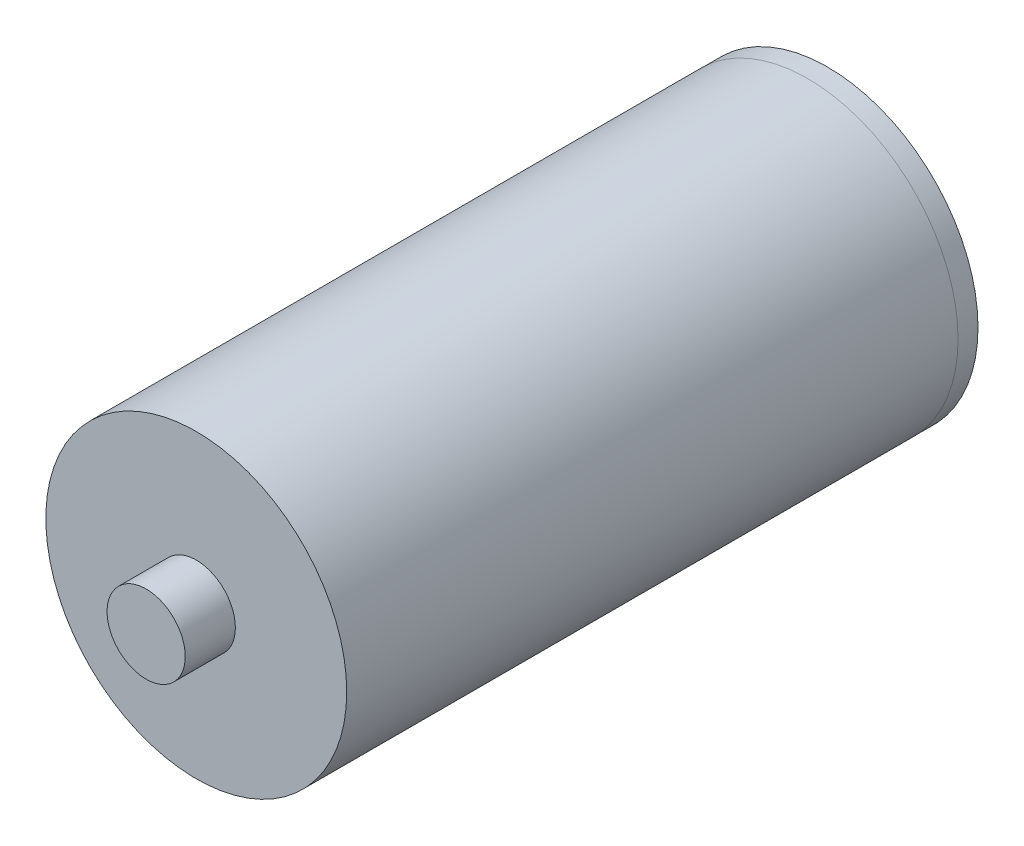
from build123d import *

# Parameters (mm, degrees)
SKETCH1_R           = 3.5
BOSS_EXTRUDE1_DEPTH = 3.25
SKETCH3_R           = 15
BOSS_EXTRUDE2_DEPTH = 2
SKETCH4_R           = 15.011076053
SKETCH4_R_2         = 13.011076053
BOSS_EXTRUDE3_DEPTH = 59
CUT_EXTRUDE1_DEPTH  = 5
SKETCH6_R           = 15.011076053
BOSS_EXTRUDE4_DEPTH = 2
SKETCH7_R           = 3.9
BOSS_EXTRUDE5_DEPTH = 5


with BuildPart() as part:
    # Sketch1 → Boss-Extrude1 (new body)
    with BuildSketch(Plane.XY):
        with Locations((0.700759494, -0.350379747)):
            Circle(SKETCH1_R)
        with BuildLine():
            Line((-1.299240506, 1.149620253), (0.700759494, 1.149620253))
            Line((0.700759494, 1.149620253), (2.700759494, 1.149620253))
            ThreePointArc((2.700759494, 1.149620253), (3.200759494, -0.350379747), (2.700759494, -1.850379747))
            Line((2.700759494, -1.850379747), (-1.299240506, -1.850379747))
            ThreePointArc((-1.299240506, -1.850379747), (-1.799240506, -0.350379747), (-1.299240506, 1.149620253))
        make_face(mode=Mode.SUBTRACT)
    extrude(amount=BOSS_EXTRUDE1_DEPTH)

    # Sketch3 → Boss-Extrude2 (add)
    with BuildSketch(Plane.XY.offset(3.25)):
        with Locations((0.700759494, -0.350379747)):
            Circle(SKETCH3_R)
    extrude(amount=BOSS_EXTRUDE2_DEPTH)

    # Sketch4 → Boss-Extrude3 (add)
    with BuildSketch(Plane.XY.offset(5.25)):
        with Locations((0.700759494, -0.350379747)):
            Circle(SKETCH4_R)
        with Locations((0.700759494, -0.350379747)):
            Circle(SKETCH4_R_2, mode=Mode.SUBTRACT)
    extrude(amount=BOSS_EXTRUDE3_DEPTH)

    # Sketch5 → Cut-Extrude1 (cut)
    with BuildSketch(Plane(origin=(0, 0, 3.25), x_dir=(-1, 0, 0), z_dir=(0, 0, -1))):
        with BuildLine():
            Line((-2.700759494, -1.850379747), (1.299240506, -1.850379747))
            ThreePointArc((1.299240506, -1.850379747), (1.799240506, -0.350379747), (1.299240506, 1.149620253))
            Line((1.299240506, 1.149620253), (-2.700759494, 1.149620253))
            ThreePointArc((-2.700759494, 1.149620253), (-3.200759494, -0.350379747), (-2.700759494, -1.850379747))
        make_face()
    extrude(amount=-CUT_EXTRUDE1_DEPTH, mode=Mode.SUBTRACT)

    # Sketch6 → Boss-Extrude4 (add)
    with BuildSketch(Plane.XY.offset(64.25)):
        with Locations((0.700759494, -0.350379747)):
            Circle(SKETCH6_R)
    extrude(amount=BOSS_EXTRUDE4_DEPTH)

    # Sketch7 → Boss-Extrude5 (add)
    with BuildSketch(Plane.XY.offset(66.25)):
        with Locations((0.700759494, -0.350379747)):
            Circle(SKETCH7_R)
    extrude(amount=BOSS_EXTRUDE5_DEPTH)


solid = part.part
